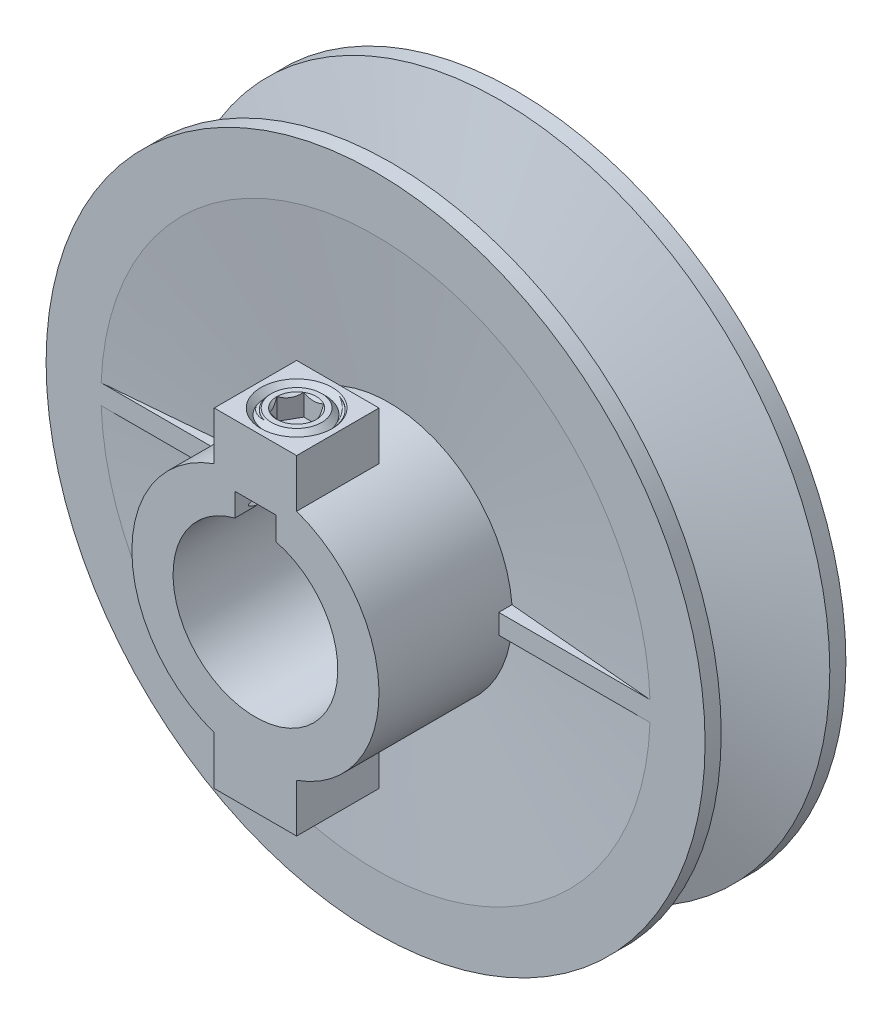
from build123d import *

# Parameters (mm, degrees)
BOSS_EXTRUDE1_DEPTH      = 1.143
CIRPATTERN1_COUNT        = 2
SKETCH3_R                = 9.525
CUT_EXTRUDE1_DEPTH       = 30.1752
SKETCH4_W                = 4.7625
SKETCH4_H                = 4.7625
CUT_EXTRUDE2_DEPTH       = 30.1752
BOSS_EXTRUDE2_REACH      = 75.185
BOSS_EXTRUDE2_END_RADIUS = 14.2875
BOSS_EXTRUDE2_START      = 4.7625
SKETCH5_W                = 9.525
SKETCH5_H                = 9.525
SKETCH6_R                = 3.086805556
CUT_EXTRUDE3_DEPTH       = 19.05
CUT_SWEEP1_PITCH         = 1.411111111
CUT_SWEEP2_PITCH         = 1.411111111
CUT_EXTRUDE5_DEPTH       = 2.48046875


with BuildPart() as part:
    # Sketch1 → Revolve1 (revolve)
    with BuildSketch(Plane(origin=(0, 0, 0), x_dir=(0, 0, -1), z_dir=(1, 0, 0)), mode=Mode.PRIVATE) as revolve1_sk:
        Polygon((6.279294914, 38.1), (8.1407, 38.1), (8.1407, 31.75), (6.612929213, 14.2875), (8.1407, 14.2875), (8.1407, 0), (-22.0345, 0), (-22.0345, 14.2875), (-7.747, 14.2875), (-6.612929213, 14.2875), (-8.1407, 31.75), (-8.1407, 38.1), (-6.279294914, 38.1), (-2.396515259, 25.4), (2.396515259, 25.4), align=None)
    revolve(revolve1_sk.sketch.rotate(Axis((0, 0, 22.0345), (0, 0, -1)), 90), axis=Axis((0, 0, 22.0345), (0, 0, -1)))

    # Sketch2 → Boss-Extrude1 (add, symmetric)
    with BuildSketch(Plane(origin=(0, 0, 0), x_dir=(0, 0, -1), z_dir=(0, 1, 0))):
        Polygon((-6.590707093, 14.0335), (-8.1407, 31.75), (-8.1407, 14.0335), align=None)
        Polygon((8.1407, 14.0335), (6.590707093, 14.0335), (8.1407, 31.75), align=None)
    boss_extrude1 = extrude(amount=BOSS_EXTRUDE1_DEPTH, both=True)

    # CirPattern1: Boss-Extrude1 ×2 about axis
    cirpattern1_axis = Axis((0, 0, 0), (0, 0, -1))
    for i in range(1, CIRPATTERN1_COUNT):
        add(boss_extrude1.rotate(cirpattern1_axis, i * 360 / CIRPATTERN1_COUNT))

    # Sketch3 → Cut-Extrude1 (cut)
    with BuildSketch(Plane(origin=(0, 0, -8.1407), x_dir=(-1, 0, 0), z_dir=(0, 0, -1))):
        with Locations(Location((0, 0, 0), (0, 0, 90))):
            Circle(SKETCH3_R)
    extrude(amount=-CUT_EXTRUDE1_DEPTH, mode=Mode.SUBTRACT)

    # Sketch4 → Cut-Extrude2 (cut)
    with BuildSketch(Plane(origin=(0, 0, -8.1407), x_dir=(-1, 0, 0), z_dir=(0, 0, -1))):
        with Locations((0, 9.525)):
            Rectangle(SKETCH4_W, SKETCH4_H)
    extrude(amount=-CUT_EXTRUDE2_DEPTH, mode=Mode.SUBTRACT)

    # Boss-Extrude2: up to this cylinder (the profile starts outside it)
    boss_extrude2_end = Plane(origin=(0, 0, 17.272), z_dir=(0, 0, 1)) * Cylinder(BOSS_EXTRUDE2_END_RADIUS, 179.945, mode=Mode.PRIVATE)
    # Sketch5 → Boss-Extrude2 (add, up to the surface)
    with BuildSketch(Plane(origin=(0, 14.2875, 0), x_dir=(-1, 0, 0), z_dir=(0, 1, 0)).offset(BOSS_EXTRUDE2_START), mode=Mode.PRIVATE) as boss_extrude2_sk1:
        with Locations((0, 17.272)):
            Rectangle(SKETCH5_W, SKETCH5_H)
    boss_extrude2_tool1 = extrude(boss_extrude2_sk1.sketch, amount=-BOSS_EXTRUDE2_REACH, mode=Mode.PRIVATE) - boss_extrude2_end
    boss_extrude2 = boss_extrude2_tool1.solids().sort_by_distance((0, 19.05, 17.272))[0]
    add(boss_extrude2)

    # Mirror1: Boss-Extrude2 across plane
    add(boss_extrude2.mirror(Plane.ZX))

    # Sketch6 → Cut-Extrude3 (cut)
    with BuildSketch(Plane(origin=(0, 19.05, 0), x_dir=(-1, 0, 0), z_dir=(0, 1, 0))):
        with Locations(Location((0, 17.272, 0), (0, 0, 90))):
            Circle(SKETCH6_R)
    extrude(amount=-CUT_EXTRUDE3_DEPTH, mode=Mode.SUBTRACT)

    # Cut-Sweep1: the profile of Sketch8 screwed along a right-hand helix of 11.125 turns, 8 arcs to a turn; built about Z, then put on its axis
    cut_sweep1_z = Axis((0, 0, 0), (0, 0, 1))
    cut_sweep1_corners = [(2.975827818, 0, -1.367013889), (2.975827818, 0, -0.044097222), (3.96875, 0, -0.617361111), (3.96875, 0, -0.79375)]
    with BuildLine(mode=Mode.PRIVATE) as cut_sweep1_profile:
        Line(cut_sweep1_corners[0], cut_sweep1_corners[1])
        Line(cut_sweep1_corners[1], cut_sweep1_corners[2])
        Line(cut_sweep1_corners[2], cut_sweep1_corners[3])
        Line(cut_sweep1_corners[3], cut_sweep1_corners[0])
    cut_sweep1_cap = Face(cut_sweep1_profile.wire())
    cut_sweep1_turn_angles = [0, 22.5, 45, 67.5, 90, 112.5, 135, 157.5, 180, 202.5, 225, 247.5, 270, 292.5, 315, 337.5, 360]
    cut_sweep1_turn_weights = [1, 0.9238795325112867, 1, 0.9238795325112867, 1, 0.9238795325112867, 1, 0.9238795325112867, 1, 0.9238795325112867, 1, 0.9238795325112867, 1, 0.9238795325112867, 1, 0.9238795325112867, 1]
    cut_sweep1_turn_rails = [Edge.make_bspline([Vector(p[0], p[1], 0).rotate(cut_sweep1_z, cut_sweep1_turn_angles[k]) / cut_sweep1_turn_weights[k] + Vector(0, 0, p[2] + CUT_SWEEP1_PITCH * cut_sweep1_turn_angles[k] / 360) for k in range(17)], [0, 0, 0, 1, 1, 2, 2, 3, 3, 4, 4, 5, 5, 6, 6, 7, 7, 8, 8, 8], 2, cut_sweep1_turn_weights) for p in cut_sweep1_corners]
    cut_sweep1_turn_sides = [Face.make_surface_from_curves(cut_sweep1_turn_rails[p[0]], cut_sweep1_turn_rails[p[1]]) for p in [(0, 1), (1, 2), (2, 3), (3, 0)]]
    cut_sweep1_last_angles = [3960, 3982.5, 4005]
    cut_sweep1_last_weights = [1, 0.9238795325112579, 1]
    cut_sweep1_last_rails = [Edge.make_bspline([Vector(p[0], p[1], 0).rotate(cut_sweep1_z, cut_sweep1_last_angles[k]) / cut_sweep1_last_weights[k] + Vector(0, 0, p[2] + CUT_SWEEP1_PITCH * cut_sweep1_last_angles[k] / 360) for k in range(3)], [0, 0, 0, 1, 1, 1], 2, cut_sweep1_last_weights) for p in cut_sweep1_corners]
    cut_sweep1_last_sides = [Face.make_surface_from_curves(cut_sweep1_last_rails[p[0]], cut_sweep1_last_rails[p[1]]) for p in [(0, 1), (1, 2), (2, 3), (3, 0)]]
    cut_sweep1 = Plane(origin=(0, 19.05, 17.272), x_dir=(0, 0, 1), z_dir=(0, -1, 0)) * Solid(Shell([*[p.moved(Location((0, 0, CUT_SWEEP1_PITCH * i))) for i in range(11) for p in cut_sweep1_turn_sides], *cut_sweep1_last_sides, cut_sweep1_cap, cut_sweep1_cap.rotate(cut_sweep1_z, 4005).moved(Location((0, 0, CUT_SWEEP1_PITCH * 4005 / 360)))]))
    add(cut_sweep1, mode=Mode.SUBTRACT)

    # Cut-Extrude4 cone 1 section (through the dimple's axis) → Cut-Extrude4 (revolve, cut)
    with BuildSketch(Plane(origin=(0, 19.05, 17.272), x_dir=(0, 0, 1), z_dir=(1, 0, 0))):
        Polygon((0, 0), (4.121507259, 0), (0, 4.121507259), align=None)
    revolve(axis=Axis((0, 19.05, 17.272), (0, -1, 0)), mode=Mode.SUBTRACT)


with BuildPart() as body_2:
    # Sketch10 → Revolve3 (revolve)
    with BuildSketch(Plane(origin=(0, 0, 0), x_dir=(0, 0, -1), z_dir=(1, 0, 0))):
        Polygon((-21.24075, 12.181800811), (-21.24075, 17.980699189), (-20.171449189, 19.05), (-17.272, 19.05), (-17.272, 11.1125), (-20.171449189, 11.1125), align=None)
    revolve(axis=Axis((0, 19.05, 17.272), (0, -1, 0)))

    # Cut-Sweep2: the profile of Sketch12 screwed along a right-hand helix of 6.625 turns, 8 arcs to a turn; built about Z, then put on its axis
    cut_sweep2_z = Axis((0, 0, 0), (0, 0, 1))
    cut_sweep2_corners = [(4.045128629, 0, -0.661458333), (4.045128629, 0, 0.661458333), (3.052206448, 0, 0.088194444), (3.052206448, 0, -0.088194444)]
    with BuildLine(mode=Mode.PRIVATE) as cut_sweep2_profile:
        Line(cut_sweep2_corners[0], cut_sweep2_corners[1])
        Line(cut_sweep2_corners[1], cut_sweep2_corners[2])
        Line(cut_sweep2_corners[2], cut_sweep2_corners[3])
        Line(cut_sweep2_corners[3], cut_sweep2_corners[0])
    cut_sweep2_cap = Face(cut_sweep2_profile.wire())
    cut_sweep2_turn_angles = [0, 22.5, 45, 67.5, 90, 112.5, 135, 157.5, 180, 202.5, 225, 247.5, 270, 292.5, 315, 337.5, 360]
    cut_sweep2_turn_weights = [1, 0.9238795325112867, 1, 0.9238795325112867, 1, 0.9238795325112867, 1, 0.9238795325112867, 1, 0.9238795325112867, 1, 0.9238795325112867, 1, 0.9238795325112867, 1, 0.9238795325112867, 1]
    cut_sweep2_turn_rails = [Edge.make_bspline([Vector(p[0], p[1], 0).rotate(cut_sweep2_z, cut_sweep2_turn_angles[k]) / cut_sweep2_turn_weights[k] + Vector(0, 0, p[2] + CUT_SWEEP2_PITCH * cut_sweep2_turn_angles[k] / 360) for k in range(17)], [0, 0, 0, 1, 1, 2, 2, 3, 3, 4, 4, 5, 5, 6, 6, 7, 7, 8, 8, 8], 2, cut_sweep2_turn_weights) for p in cut_sweep2_corners]
    cut_sweep2_turn_sides = [Face.make_surface_from_curves(cut_sweep2_turn_rails[p[0]], cut_sweep2_turn_rails[p[1]]) for p in [(0, 1), (1, 2), (2, 3), (3, 0)]]
    cut_sweep2_last_angles = [2160, 2182.5, 2205, 2227.5, 2250, 2272.5, 2295, 2317.5, 2340, 2362.5, 2385]
    cut_sweep2_last_weights = [1, 0.9238795325112867, 1, 0.9238795325112867, 1, 0.9238795325112867, 1, 0.9238795325112867, 1, 0.9238795325112624, 1]
    cut_sweep2_last_rails = [Edge.make_bspline([Vector(p[0], p[1], 0).rotate(cut_sweep2_z, cut_sweep2_last_angles[k]) / cut_sweep2_last_weights[k] + Vector(0, 0, p[2] + CUT_SWEEP2_PITCH * cut_sweep2_last_angles[k] / 360) for k in range(11)], [0, 0, 0, 1, 1, 2, 2, 3, 3, 4, 4, 5, 5, 5], 2, cut_sweep2_last_weights) for p in cut_sweep2_corners]
    cut_sweep2_last_sides = [Face.make_surface_from_curves(cut_sweep2_last_rails[p[0]], cut_sweep2_last_rails[p[1]]) for p in [(0, 1), (1, 2), (2, 3), (3, 0)]]
    cut_sweep2 = Plane(origin=(0, 19.05, 17.272), x_dir=(0, 0, 1), z_dir=(0, -1, 0)) * Solid(Shell([*[p.moved(Location((0, 0, CUT_SWEEP2_PITCH * i))) for i in range(6) for p in cut_sweep2_turn_sides], *cut_sweep2_last_sides, cut_sweep2_cap, cut_sweep2_cap.rotate(cut_sweep2_z, 2385).moved(Location((0, 0, CUT_SWEEP2_PITCH * 2385 / 360)))]))
    add(cut_sweep2, mode=Mode.SUBTRACT)

    # Sketch13 → Cut-Extrude5 (cut)
    with BuildSketch(Plane(origin=(0, 19.05, 0), x_dir=(1, 0, 0), z_dir=(0, 1, 0))):
        Polygon((2.291358881, -17.272), (1.14567944, -15.287625), (-1.14567944, -15.287625), (-2.291358881, -17.272), (-1.14567944, -19.256375), (1.14567944, -19.256375), align=None)
    extrude(amount=-CUT_EXTRUDE5_DEPTH, mode=Mode.SUBTRACT)

    # Cut-Extrude6 cone 1 section (through the dimple's axis) → Cut-Extrude6 (revolve, cut)
    with BuildSketch(Plane(origin=(0, 19.05, 17.272), x_dir=(0, 0, 1), z_dir=(1, 0, 0))):
        Polygon((0, 0), (2.291358881, 0), (0, 2.291358881), align=None)
    revolve(axis=Axis((0, 19.05, 17.272), (0, -1, 0)), mode=Mode.SUBTRACT)


solid = Compound([part.part, body_2.part])
